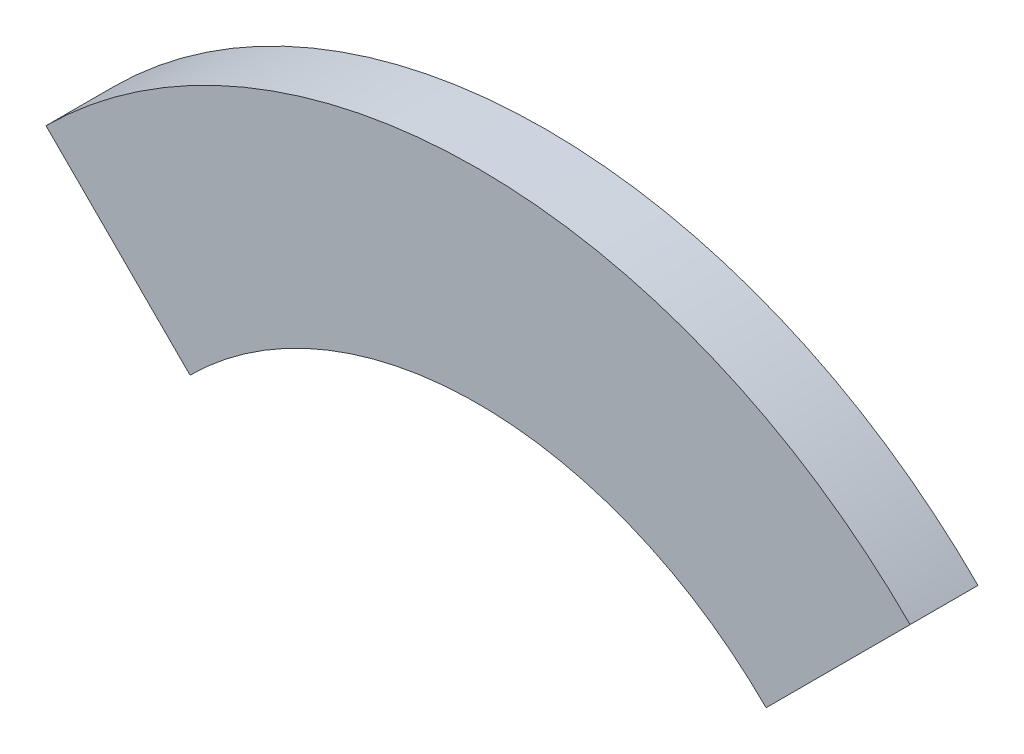
from build123d import *

# Parameters (mm, degrees)
SKETCH2_W = 76.2
SKETCH2_H = 25.4


with BuildPart() as part:
    # Sweep1: sweep along a path in Sketch1
    with BuildLine(Plane.XY) as sweep1_path:
        ThreePointArc((-127, 127), (0, 179.605122421), (127, 127))
    # Sketch2 → Sweep1 (sweep)
    with BuildSketch(Plane(origin=(0, 0, 0), x_dir=(0.7071067811865457, -0.7071067811865495, 0), z_dir=(-0.7071067811865495, -0.7071067811865457, 0))):
        with Locations((-190.5, 0)):
            Rectangle(SKETCH2_W, SKETCH2_H)
    sweep(path=sweep1_path.line)


solid = part.part
